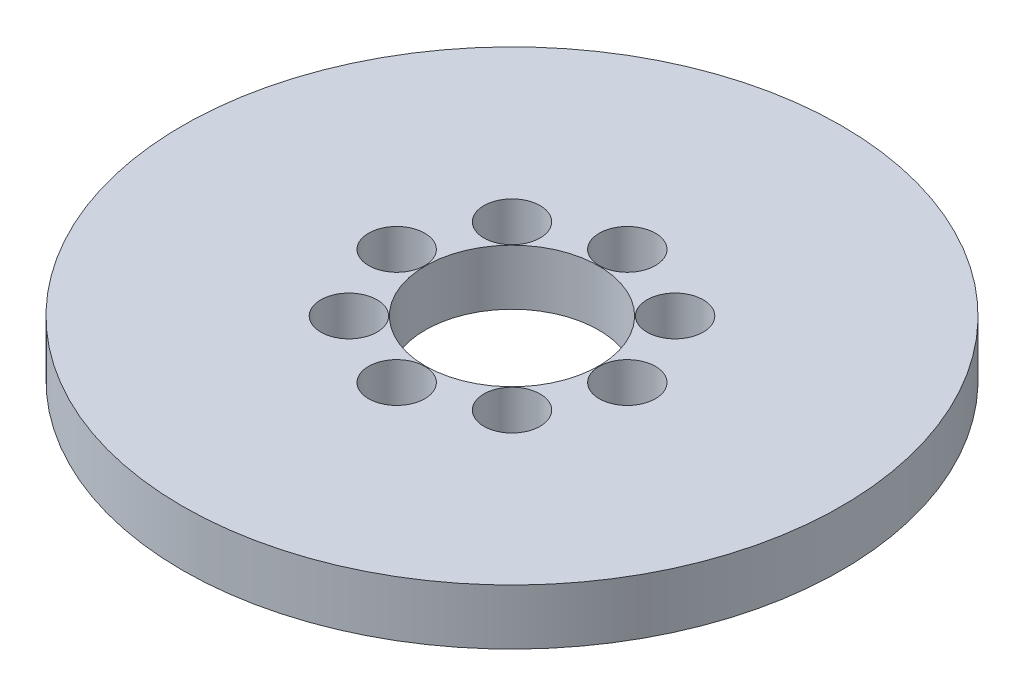
from build123d import *

# Parameters (mm, degrees)
SKETCH1_R           = 95
BOSS_EXTRUDE1_DEPTH = 16
SKETCH2_R           = 25
CUT_EXTRUDE1_DEPTH  = 136.299667405
SKETCH3_R           = 8.098905889
CUT_EXTRUDE2_DEPTH  = 14.63104318
CIRPATTERN1_COUNT   = 8


with BuildPart() as part:
    # Sketch1 → Boss-Extrude1 (new body)
    with BuildSketch(Plane(origin=(0, 0, 0), x_dir=(1, 0, 0), z_dir=(0, 1, 0))):
        Circle(SKETCH1_R)
    extrude(amount=BOSS_EXTRUDE1_DEPTH)

    # Sketch2 → Cut-Extrude1 (cut, through all)
    with BuildSketch(Plane(origin=(0, 0, 0), x_dir=(1, 0, 0), z_dir=(0, 1, 0))):
        Circle(SKETCH2_R)
    extrude(amount=CUT_EXTRUDE1_DEPTH, mode=Mode.SUBTRACT)

    # Sketch3 → Cut-Extrude2 (cut)
    with BuildSketch(Plane(origin=(0, 16, 0), x_dir=(1, 0, 0), z_dir=(0, 1, 0))):
        with Locations((-33.243670808, 0)):
            Circle(SKETCH3_R)
    cut_extrude2 = extrude(amount=-CUT_EXTRUDE2_DEPTH, mode=Mode.SUBTRACT)

    # CirPattern1: Cut-Extrude2 ×8 about axis
    cirpattern1_axis = Axis((0, 0, 0), (0, 1, 0))
    for i in range(1, CIRPATTERN1_COUNT):
        add(cut_extrude2.rotate(cirpattern1_axis, i * 360 / CIRPATTERN1_COUNT), mode=Mode.SUBTRACT)


solid = part.part
